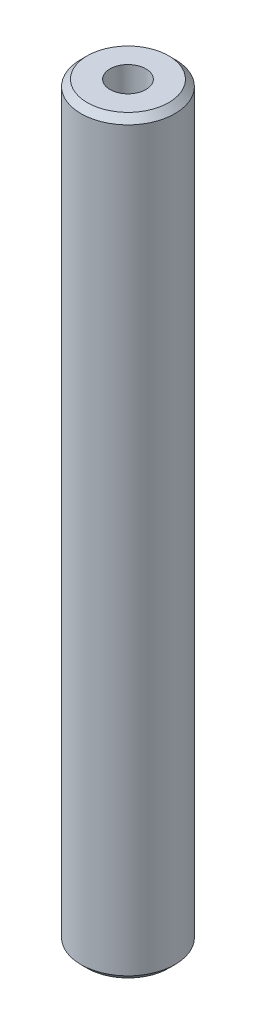
from build123d import *

# Parameters (mm, degrees)
SKETCH1_R           = 37.5
BOSS_EXTRUDE1_DEPTH = 598.097056935
SKETCH2_R           = 14.334222948
CUT_EXTRUDE1_DEPTH  = 601.443660566
CHAMFER1_SIZE       = 5.059586244


with BuildPart() as part:
    # Sketch1 → Boss-Extrude1 (new body)
    with BuildSketch(Plane(origin=(0, 0, 0), x_dir=(1, 0, 0), z_dir=(0, 1, 0))):
        Circle(SKETCH1_R)
    extrude(amount=BOSS_EXTRUDE1_DEPTH)

    # Sketch2 → Cut-Extrude1 (cut, through all)
    with BuildSketch(Plane(origin=(0, 0, 0), x_dir=(1, 0, 0), z_dir=(0, 1, 0))):
        Circle(SKETCH2_R)
    extrude(amount=CUT_EXTRUDE1_DEPTH, mode=Mode.SUBTRACT)

    # Chamfer1
    chamfer1_edges = [part.edges().sort_by_distance(p)[0] for p in [
        (-37.5, 598.097056935, 0),
        (-37.5, 0, 0),
    ]]
    chamfer(chamfer1_edges, length=CHAMFER1_SIZE)


solid = part.part
